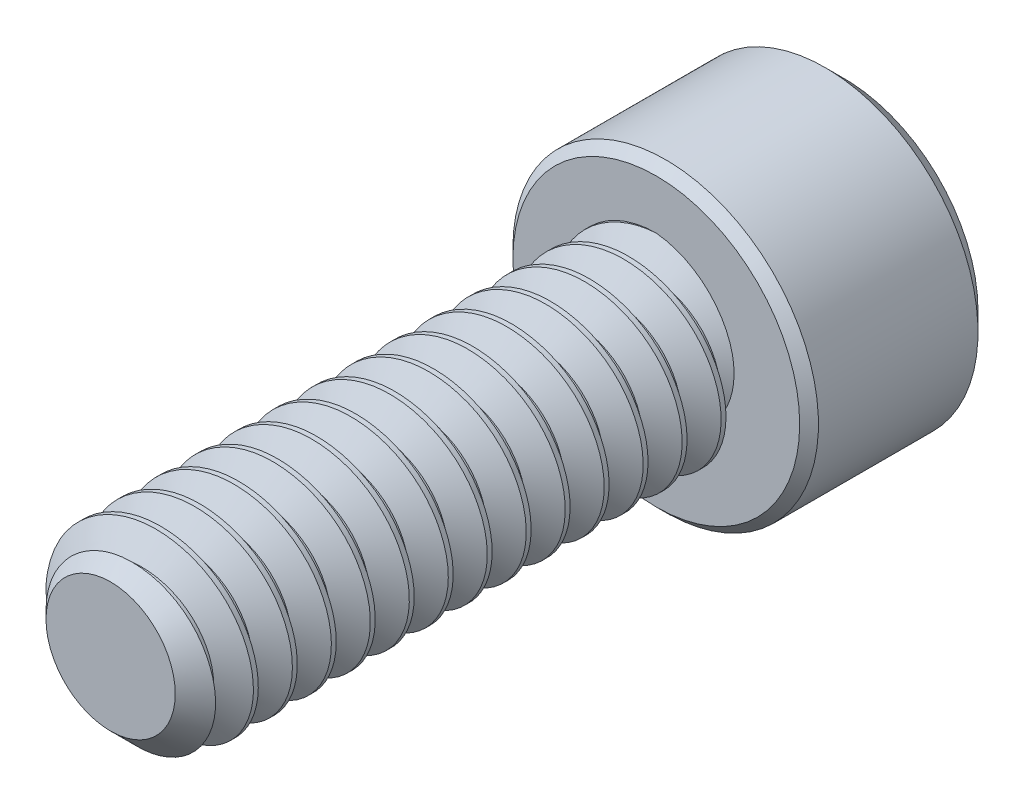
from build123d import *

# Parameters (mm, degrees)
SKETCH1_R          = 1.0922
EXTRUDE1_DEPTH     = 6.35
CHAMFER3_SIZE      = 0.340178571
CUT_SWEEP1_PITCH   = 0.453571429
SKETCH6_R          = 1.778
EXTRUDE2_DEPTH     = 2.1844
CUT_EXTRUDE1_DEPTH = 1.48828125
SKETCH8_R          = 1.14567944
CUT_EXTRUDE2_DEPTH = 0.21844
CUT_EXTRUDE2_DRAFT = -45
CHAMFER1_SIZE      = 0.21844
CHAMFER2_SIZE      = 0.10922


with BuildPart() as part:
    # Sketch1 → Extrude1 (new body)
    with BuildSketch(Plane.XY):
        Circle(SKETCH1_R)
    extrude(amount=-EXTRUDE1_DEPTH)

    # Chamfer3
    chamfer3_edges = [part.edges().sort_by_distance(p)[0] for p in [
        (-1.0922, 0, 0),
    ]]
    chamfer(chamfer3_edges, length=CHAMFER3_SIZE)

    # Cut-Sweep1: the profile of Sketch3 profile screwed along a right-hand helix of 15 turns, 6 arcs to a turn; built about Z, then put on its axis
    cut_sweep1_z = Axis((0, 0, 0), (0, 0, 1))
    cut_sweep1_corners = [(1.0925, 0, -0.397048205), (0.797596715, 0, -0.226785714), (0.797596715, 0, -0.170089286), (1.0925, 0, 0.000173205)]
    with BuildLine(mode=Mode.PRIVATE) as cut_sweep1_profile:
        Line(cut_sweep1_corners[0], cut_sweep1_corners[1])
        Line(cut_sweep1_corners[1], cut_sweep1_corners[2])
        Line(cut_sweep1_corners[2], cut_sweep1_corners[3])
        Line(cut_sweep1_corners[3], cut_sweep1_corners[0])
    cut_sweep1_cap = Face(cut_sweep1_profile.wire())
    cut_sweep1_turn_angles = [0, 30, 60, 90, 120, 150, 180, 210, 240, 270, 300, 330, 360]
    cut_sweep1_turn_weights = [1, 0.8660254037844387, 1, 0.8660254037844387, 1, 0.8660254037844387, 1, 0.8660254037844387, 1, 0.8660254037844387, 1, 0.8660254037844387, 1]
    cut_sweep1_turn_rails = [Edge.make_bspline([Vector(p[0], p[1], 0).rotate(cut_sweep1_z, cut_sweep1_turn_angles[k]) / cut_sweep1_turn_weights[k] + Vector(0, 0, p[2] + CUT_SWEEP1_PITCH * cut_sweep1_turn_angles[k] / 360) for k in range(13)], [0, 0, 0, 1, 1, 2, 2, 3, 3, 4, 4, 5, 5, 6, 6, 6], 2, cut_sweep1_turn_weights) for p in cut_sweep1_corners]
    cut_sweep1_turn_sides = [Face.make_surface_from_curves(cut_sweep1_turn_rails[p[0]], cut_sweep1_turn_rails[p[1]]) for p in [(0, 1), (1, 2), (2, 3), (3, 0)]]
    cut_sweep1 = Plane(origin=(0, 0, 0), x_dir=(0, 1, 0), z_dir=(0, 0, -1)) * Solid(Shell([*[p.moved(Location((0, 0, CUT_SWEEP1_PITCH * i))) for i in range(15) for p in cut_sweep1_turn_sides], cut_sweep1_cap, cut_sweep1_cap.rotate(cut_sweep1_z, 5400).moved(Location((0, 0, CUT_SWEEP1_PITCH * 5400 / 360)))]))
    add(cut_sweep1, mode=Mode.SUBTRACT)

    # Sketch6 → Extrude2 (add)
    with BuildSketch(Plane(origin=(0, 0, -6.35), x_dir=(-1, 0, 0), z_dir=(0, 0, -1))):
        Circle(SKETCH6_R)
    extrude(amount=EXTRUDE2_DEPTH)

    # Sketch7 → Cut-Extrude1 (cut)
    with BuildSketch(Plane(origin=(0, 0, -8.5344), x_dir=(-1, 0, 0), z_dir=(0, 0, -1))):
        Polygon((0, 1.14567944), (-0.9921875, 0.57283972), (-0.9921875, -0.57283972), (0, -1.14567944), (0.9921875, -0.57283972), (0.9921875, 0.57283972), align=None)
    extrude(amount=-CUT_EXTRUDE1_DEPTH, mode=Mode.SUBTRACT)


with BuildPart() as cut_extrude2_tool:
    # Sketch8 → Cut-Extrude2 (with draft: the straight prism first)
    with BuildSketch(Plane(origin=(0, 0, -8.5344), x_dir=(-1, 0, 0), z_dir=(0, 0, -1))):
        Circle(SKETCH8_R)
    extrude(amount=-CUT_EXTRUDE2_DEPTH)
    # Cut-Extrude2: the draft: its side faces are tilted about the plane it starts from
    cut_extrude2_sides = [cut_extrude2_tool.faces().sort_by_distance(p)[0] for p in [
        (1.14567944, 0, -8.42518),
    ]]
    draft(cut_extrude2_sides, Plane(origin=(0, 0, -8.5344), x_dir=(-1, 0, 0), z_dir=(0, 0, -1)), CUT_EXTRUDE2_DRAFT)


with BuildPart() as part_1:
    add(part.part)

    # Cut-Extrude2: cut by cut_extrude2_tool
    add(cut_extrude2_tool.part, mode=Mode.SUBTRACT)

    # Chamfer1
    chamfer1_edges = [part_1.edges().sort_by_distance(p)[0] for p in [
        (1.778, 0, -8.5344),
    ]]
    chamfer(chamfer1_edges, length=CHAMFER1_SIZE)

    # Chamfer2
    chamfer2_edges = [part_1.edges().sort_by_distance(p)[0] for p in [
        (1.778, 0, -6.35),
    ]]
    chamfer(chamfer2_edges, length=CHAMFER2_SIZE)


solid = part_1.part
